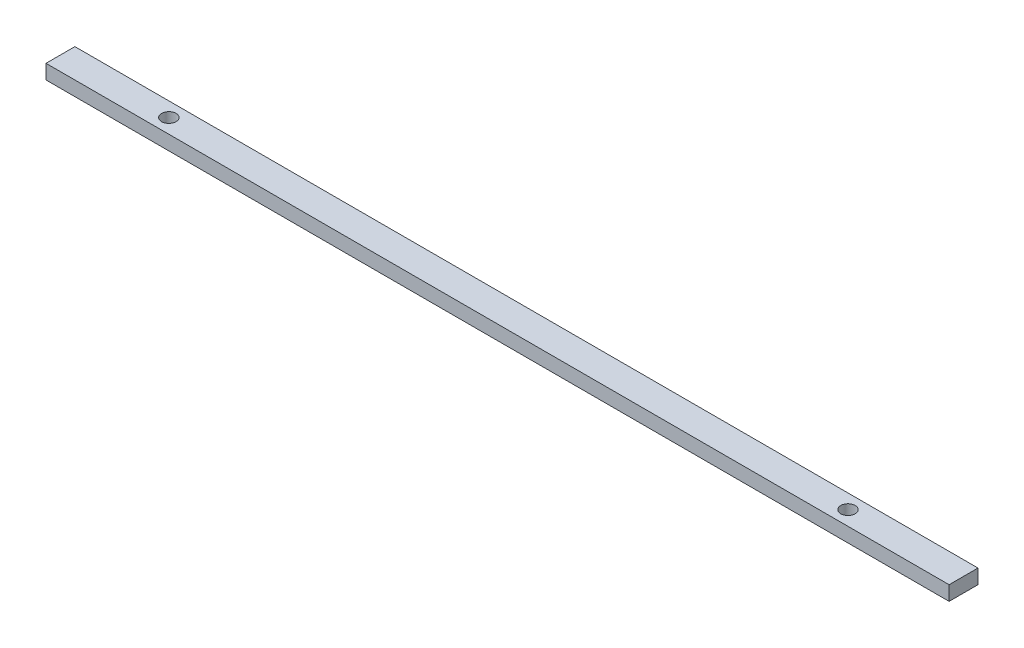
from build123d import *

# Parameters (mm, degrees)
SKETCH_1_W          = 375
SKETCH_1_H          = 12
EXTRUDE_1_DEPTH     = 6
SKETCH_2_R          = 3
CUT_EXTRUDE_1_DEPTH = 376.239923249


with BuildPart() as part:
    # Эскиз1 → Бобышка-Вытянуть1 (new body)
    with BuildSketch(Plane(origin=(0, 0, 0), x_dir=(1, 0, 0), z_dir=(0, 1, 0))):
        with Locations((187.5, 6)):
            Rectangle(SKETCH_1_W, SKETCH_1_H)
    extrude(amount=EXTRUDE_1_DEPTH)

    # Эскиз2 → Вырез-Вытянуть1 (cut, through all)
    with BuildSketch(Plane(origin=(0, 6, 0), x_dir=(1, 0, 0), z_dir=(0, 1, 0))):
        with Locations((45, 6)):
            Circle(SKETCH_2_R)
        with Locations((327, 6)):
            Circle(SKETCH_2_R)
    extrude(amount=-CUT_EXTRUDE_1_DEPTH, mode=Mode.SUBTRACT)


solid = part.part
